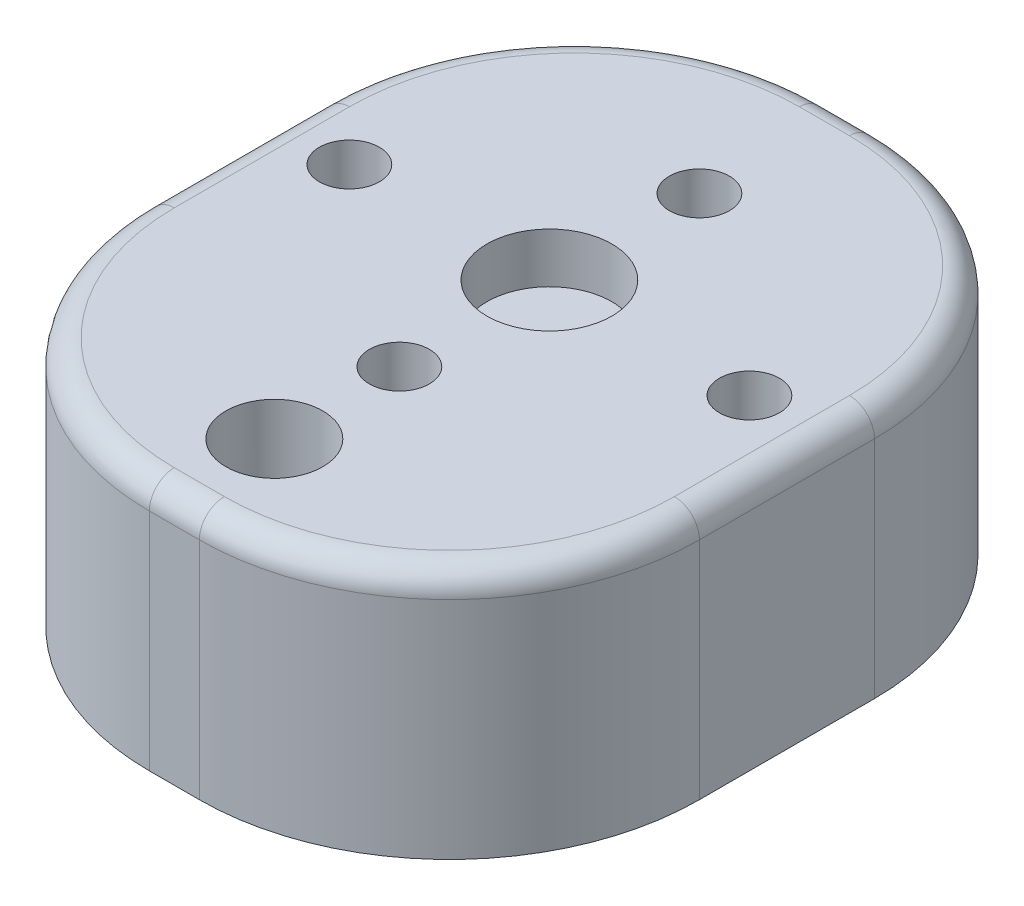
from build123d import *

# Parameters (mm, degrees)
BOSS_EXTRU_1_DEPTH      = 22
D_GAGEMENT_M21_D        = 2.4
ESQUISSE5_W             = 22
ESQUISSE5_H             = 10
BOSS_EXTRU_2_DEPTH      = 5
CONG_1_R                = 10
CONG_3_R                = 1
ENL_V_MAT_EXTRU_2_DEPTH = 3
ESQUISSE12_R            = 1.9376057
ENL_V_MAT_EXTRU_3_DEPTH = 37.235341952
ESQUISSE13_R            = 2.5
ENL_V_MAT_EXTRU_4_DEPTH = 2


with BuildPart() as part:
    # Esquisse1 → Boss.-Extru.1 (new body)
    with BuildSketch(Plane.XY):
        with BuildLine():
            Line((0, 10), (0, 0))
            Line((0, 0), (6, 0))
            ThreePointArc((6, 0), (11, 5), (16, 0))
            Line((16, 0), (22, 0))
            Line((22, 0), (22, 10))
            Line((22, 10), (0, 10))
        make_face()
    extrude(amount=BOSS_EXTRU_1_DEPTH)

    # Dégagement M21 (through all)
    with Locations(Plane(origin=(0, 10, 0), x_dir=(1, 0, 0), z_dir=(0, 1, 0))):
        with Locations((11, -6), (11, -18), (3, -12), (19, -12)):
            Hole(D_GAGEMENT_M21_D / 2)

    # Esquisse5 → Boss.-Extru.2 (add)
    with BuildSketch(Plane.XY.offset(22)):
        with Locations((11, 5)):
            Rectangle(ESQUISSE5_W, ESQUISSE5_H)
    extrude(amount=BOSS_EXTRU_2_DEPTH)

    # Congé1
    # the kernel refuses this fillet: 10 mm, written as the material it takes off along each edge
    with BuildSketch(Plane(origin=(0, 35, 0), x_dir=(0, 0, 1), z_dir=(0, -1, 0))) as cong_1_piece_1:
        with BuildLine():
            CenterArc((CONG_1_R, -CONG_1_R), CONG_1_R, 90, 90)
            Line((0, -CONG_1_R), (0, 0))
            Line((0, 0), (CONG_1_R, 0))
        make_face()
    extrude(amount=60, mode=Mode.SUBTRACT)
    with BuildSketch(Plane(origin=(0, 35, 27), x_dir=(0, 0, -1), z_dir=(0, -1, 0)), Plane(origin=(22, -25, 0), x_dir=(-1, 0, 0), z_dir=(0, 1, 0)), Plane(origin=(22, -25, 27), x_dir=(0, 0, -1), z_dir=(0, 1, 0))) as cong_1_piece_2:
        with BuildLine():
            CenterArc((CONG_1_R, CONG_1_R), CONG_1_R, 180, 90)
            Line((0, CONG_1_R), (0, 0))
            Line((0, 0), (CONG_1_R, 0))
        make_face()
    extrude(amount=60, mode=Mode.SUBTRACT)

    # Congé3
    cong_3_edges = [part.edges().sort_by_distance(p)[0] for p in [
        (11, 10, 0),
        (0, 10, 13.5),
        (11, 10, 27),
        (22, 10, 13.5),
        (19.071067812, 10, 24.071067812),
        (19.071067812, 10, 2.928932188),
        (2.928932188, 10, 24.071067812),
        (2.928932188, 10, 2.928932188),
    ]]
    fillet(cong_3_edges, radius=CONG_3_R)

    # Esquisse10 → Enlèv. mat.-Extru.2 (cut)
    with BuildSketch(Plane(origin=(0, 0, 22), x_dir=(-1, 0, 0), z_dir=(0, 0, -1))):
        with BuildLine():
            Line((-7, 0), (-15, 0))
            ThreePointArc((-15, 0), (-11, 4), (-7, 0))
        make_face()
    extrude(amount=-ENL_V_MAT_EXTRU_2_DEPTH, mode=Mode.SUBTRACT)

    # Esquisse12 → Enlèv. mat.-Extru.3 (cut, through all)
    with BuildSketch(Plane(origin=(0, 10, 0), x_dir=(1, 0, 0), z_dir=(0, 1, 0))):
        with Locations(Location((11, -23, 0), (0, 0, 270))):
            Circle(ESQUISSE12_R)
    extrude(amount=-ENL_V_MAT_EXTRU_3_DEPTH, mode=Mode.SUBTRACT)

    # Esquisse13 → Enlèv. mat.-Extru.4 (cut)
    with BuildSketch(Plane(origin=(0, 10, 0), x_dir=(1, 0, 0), z_dir=(0, 1, 0))):
        with Locations(Location((11, -12, 0), (0, 0, 270))):
            Circle(ESQUISSE13_R)
    extrude(amount=-ENL_V_MAT_EXTRU_4_DEPTH, mode=Mode.SUBTRACT)


solid = part.part
